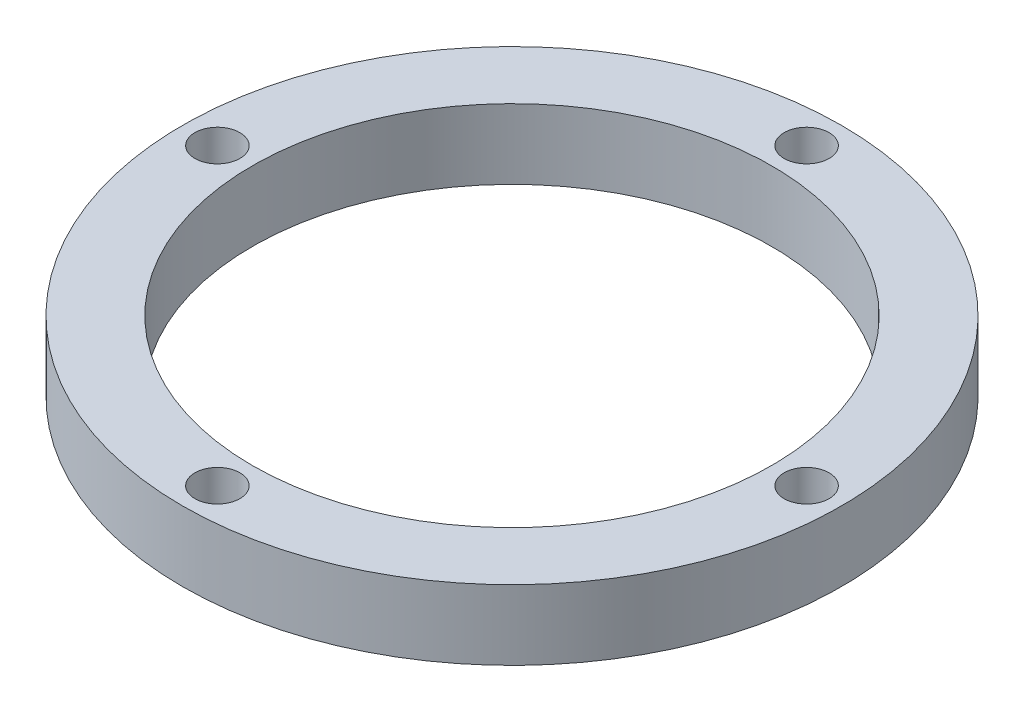
from build123d import *

# Parameters (mm, degrees)
SKETCH1_R           = 33
SKETCH1_R_2         = 26
BOSS_EXTRUDE1_DEPTH = 7
SKETCH5_R           = 2.25
CUT_EXTRUDE1_DEPTH  = 48.191100856
CIRPATTERN1_COUNT   = 4


with BuildPart() as part:
    # Sketch1 → Boss-Extrude1 (new body)
    with BuildSketch(Plane(origin=(0, 0, 0), x_dir=(1, 0, 0), z_dir=(0, 1, 0))):
        Circle(SKETCH1_R)
        Circle(SKETCH1_R_2, mode=Mode.SUBTRACT)
    extrude(amount=BOSS_EXTRUDE1_DEPTH)

    # Sketch5 → Cut-Extrude1 (cut, through all)
    with BuildSketch(Plane(origin=(0, 7, 0), x_dir=(1, 0, 0), z_dir=(0, 1, 0))):
        with Locations((29.5, 0)):
            Circle(SKETCH5_R)
    cut_extrude1 = extrude(amount=-CUT_EXTRUDE1_DEPTH, mode=Mode.SUBTRACT)

    # CirPattern1: Cut-Extrude1 ×4 about axis
    cirpattern1_axis = Axis((0, 0, 0), (0, 1, 0))
    for i in range(1, CIRPATTERN1_COUNT):
        add(cut_extrude1.rotate(cirpattern1_axis, i * 360 / CIRPATTERN1_COUNT), mode=Mode.SUBTRACT)


solid = part.part
